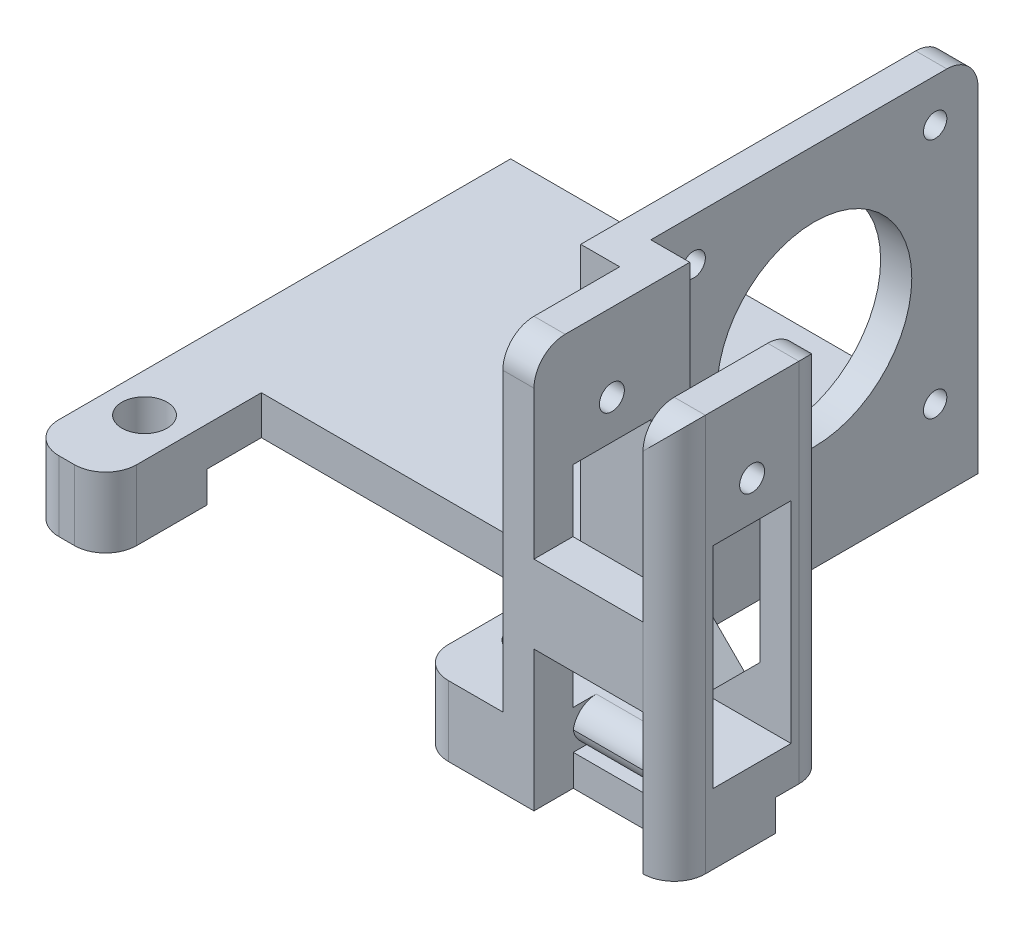
from build123d import *

# Parameters (mm, degrees)
EXTRUDE_1_DEPTH      = 5
SKETCH_3_W           = 4
SKETCH_3_H           = 42
EXTRUDE_2_DEPTH      = 42
SKETCH_4_R           = 1.5
CUT_EXTRUDE_1_DEPTH  = 42.5
SKETCH_5_R           = 12.5
CUT_EXTRUDE_2_DEPTH  = 42.5
SKETCH_6_R           = 1.5
CUT_EXTRUDE_3_DEPTH  = 42.5
SKETCH_7_W           = 20
SKETCH_7_H           = 5
EXTRUDE_3_DEPTH      = 5
EXTRUDE_5_DEPTH      = 42
SKETCH_11_W          = 20
SKETCH_11_H          = 5
EXTRUDE_6_DEPTH      = 18
SKETCH_12_W          = 4
SKETCH_12_H          = 20
EXTRUDE_7_DEPTH      = 42
CUT_EXTRUDE_4_REACH  = 106.221
SKETCH_13_R          = 1.6
CUT_EXTRUDE_START    = -22
SKETCH_15_W          = 10
SKETCH_15_H          = 27
CUT_EXTRUDE_5_DEPTH  = 22
SKETCH_16_W          = 5
SKETCH_16_H          = 5
CUT_EXTRUDE_6_DEPTH  = 42
EXTRUDE_START        = -22
SKETCH_17_W          = 10
SKETCH_17_H          = 5
EXTRUDE_8_DEPTH      = 22
CUT_EXTRUDE_7_DEPTH  = 5
FILLET_1_R           = 4
SKETCH_20_W          = 14
SKETCH_20_H          = 5
CUT_EXTRUDE_8_DEPTH  = 5
FILLET_3_R           = 3
SKETCH_21_R          = 2.9
CUT_EXTRUDE_9_DEPTH  = 3
EXTRUDE_9_DEPTH      = 4
SKETCH_24_R          = 1.5
CUT_EXTRUDE_10_DEPTH = 4
SKETCH_26_R          = 2.9
CUT_EXTRUDE_15_DEPTH = 4
CHAMFER_1_SIZE       = 7
EXTRUDE_10_REACH     = 103.064
SKETCH_28_W          = 5
SKETCH_28_H          = 10


# Some blends are built 0.0001 mm under size
with BuildPart() as part:
    # 草图1 → 凸台-拉伸1 (new body)
    with BuildSketch(Plane(origin=(0, 0, 0), x_dir=(1, 0, 0), z_dir=(0, 1, 0))):
        Polygon((10, 0), (50, 0), (50, -20), (60, -20), (60, 0), (60, 42), (0, 42), (0, 0), (0, -20), (10, -20), align=None)
    extrude(amount=EXTRUDE_1_DEPTH)

    # 草图3 → 凸台-拉伸2 (add)
    with BuildSketch(Plane(origin=(0, 5, 0), x_dir=(1, 0, 0), z_dir=(0, 1, 0))):
        with Locations((58, 21)):
            Rectangle(SKETCH_3_W, SKETCH_3_H)
    extrude(amount=EXTRUDE_2_DEPTH)

    # 草图4 → 切除-拉伸1 (cut)
    with BuildSketch(Plane.ZY.offset(-56)):
        with Locations((-36.5, 41.5)):
            Circle(SKETCH_4_R)
        with Locations((-5.5, 41.5)):
            Circle(SKETCH_4_R)
        with Locations((-5.5, 10.5)):
            Circle(SKETCH_4_R)
        with Locations((-36.5, 10.5)):
            Circle(SKETCH_4_R)
    extrude(amount=-CUT_EXTRUDE_1_DEPTH, mode=Mode.SUBTRACT)

    # 草图5 → 切除-拉伸2 (cut)
    with BuildSketch(Plane.ZY.offset(-56)):
        with Locations((-21, 26)):
            Circle(SKETCH_5_R)
    extrude(amount=-CUT_EXTRUDE_2_DEPTH, mode=Mode.SUBTRACT)

    # 草图6 → 切除-拉伸3 (cut)
    with BuildSketch(Plane(origin=(0, 5, 0), x_dir=(1, 0, 0), z_dir=(0, 1, 0))):
        with Locations(Location((55, -10, 0), (0, 0, 270))):
            Circle(SKETCH_6_R)
        with Locations(Location((5, -10, 0), (0, 0, 270))):
            Circle(SKETCH_6_R)
    extrude(amount=-CUT_EXTRUDE_3_DEPTH, mode=Mode.SUBTRACT)

    # 草图7 → 凸台-拉伸3 (add)
    with BuildSketch(Plane(origin=(60, 0, 0), x_dir=(0, 0, -1), z_dir=(1, 0, 0))):
        with Locations((-10, 2.5)):
            Rectangle(SKETCH_7_W, SKETCH_7_H)
    extrude(amount=EXTRUDE_3_DEPTH)

    # 草图8 → 凸台-拉伸5 (add)
    with BuildSketch(Plane(origin=(0, 5, 0), x_dir=(1, 0, 0), z_dir=(0, 1, 0))):
        Polygon((65, 0), (56, 0), (56, -5), (61, -5), (61, -15), (56, -15), (56, -20), (65, -20), align=None)
    extrude(amount=EXTRUDE_5_DEPTH)

    # 草图11 → 凸台-拉伸6 (add)
    with BuildSketch(Plane(origin=(65, 0, 0), x_dir=(0, 0, -1), z_dir=(1, 0, 0))):
        with Locations((-10, 2.5)):
            Rectangle(SKETCH_11_W, SKETCH_11_H)
    extrude(amount=EXTRUDE_6_DEPTH)

    # 草图12 → 凸台-拉伸7 (add)
    with BuildSketch(Plane(origin=(0, 5, 0), x_dir=(1, 0, 0), z_dir=(0, 1, 0))):
        with Locations((81, -10)):
            Rectangle(SKETCH_12_W, SKETCH_12_H)
    extrude(amount=EXTRUDE_7_DEPTH)

    # 切除-拉伸4: up to this face of the body (flat: up to its plane)
    cut_extrude_4_end = Plane(part.part.faces().sort_by_distance((61, 26, 10))[0])
    # 草图13 → 切除-拉伸4 (cut, up to the picked face)
    with BuildSketch(Plane(origin=(83, 0, 0), x_dir=(0, 0, -1), z_dir=(1, 0, 0)), mode=Mode.PRIVATE) as cut_extrude_4_sk1:
        with Locations((-10, 37)):
            Circle(SKETCH_13_R)
    cut_extrude_4_tool1 = split(extrude(cut_extrude_4_sk1.sketch, amount=-CUT_EXTRUDE_4_REACH, mode=Mode.PRIVATE), bisect_by=cut_extrude_4_end, keep=Keep.BOTH, mode=Mode.PRIVATE)
    add(cut_extrude_4_tool1.solids().sort_by(Axis((83, 37, 10), (-1, 0, 0)))[0], mode=Mode.SUBTRACT)

    # 草图15 → 切除-拉伸5 (cut)
    with BuildSketch(Plane.ZY.offset(-61).offset(CUT_EXTRUDE_START)):
        with Locations((10, 18.5)):
            Rectangle(SKETCH_15_W, SKETCH_15_H)
    extrude(amount=CUT_EXTRUDE_5_DEPTH, mode=Mode.SUBTRACT)

    # 草图16 → 切除-拉伸6 (cut)
    with BuildSketch(Plane(origin=(0, 47, 0), x_dir=(1, 0, 0), z_dir=(0, 1, 0))):
        with Locations((58.5, -17.5)):
            Rectangle(SKETCH_16_W, SKETCH_16_H)
    extrude(amount=-CUT_EXTRUDE_6_DEPTH, mode=Mode.SUBTRACT)

    # 草图17 → 凸台-拉伸8 (add)
    with BuildSketch(Plane.ZY.offset(-61).offset(EXTRUDE_START)):
        with Locations((10, 7.5)):
            Rectangle(SKETCH_17_W, SKETCH_17_H)
    extrude(amount=EXTRUDE_8_DEPTH)

    # 草图19 → 切除-拉伸7 (cut)
    with BuildSketch(Plane(origin=(0, 10, 0), x_dir=(1, 0, 0), z_dir=(0, 1, 0))):
        Polygon((79, -15), (83, -15), (83, -5), (79, -5), (65, -5), (61, -5), (61, -15), (65, -15), align=None)
    extrude(amount=-CUT_EXTRUDE_7_DEPTH, mode=Mode.SUBTRACT)

    # 圆角1
    fillet_1_edges = [part.edges().sort_by_distance(p)[0] for p in [
        (83, 23.5, 0),
        (83, 23.5, 20),
        (81, 47, 20),
        (81, 47, 0),
        (50, 2.5, 20),
        (10, 2.5, 20),
        (0, 2.5, 20),
        (58, 47, -42),
        (63, 47, 20),
    ]]
    fillet(fillet_1_edges, radius=FILLET_1_R - 0.0001)  # a hair under: the kernel refuses the full size

    # 草图20 → 切除-拉伸8 (cut)
    with BuildSketch(Plane.XY.offset(20)):
        with Locations((72, 2.5)):
            Rectangle(SKETCH_20_W, SKETCH_20_H)
    extrude(amount=-CUT_EXTRUDE_8_DEPTH, mode=Mode.SUBTRACT)

    # 圆角3
    # the kernel refuses this fillet: 3 mm, written as the material it takes off along each edge
    with BuildSketch(Plane(origin=(79, 0, 15), x_dir=(0, 0, -1), z_dir=(-1, 0, 0)), Plane(origin=(65, 5, 15), x_dir=(0, 0, -1), z_dir=(1, 0, 0))) as fillet_3_piece_1:
        with BuildLine():
            CenterArc((FILLET_3_R, -FILLET_3_R), FILLET_3_R, 90, 90)
            Line((0, -FILLET_3_R), (0, 0))
            Line((0, 0), (FILLET_3_R, 0))
        make_face()
    extrude(amount=14, mode=Mode.SUBTRACT)

    # 草图21 → 切除-拉伸9 (cut)
    with BuildSketch(Plane(origin=(0, 5, 0), x_dir=(1, 0, 0), z_dir=(0, 1, 0))):
        with Locations(Location((5, -10, 0), (0, 0, 270))):
            Circle(SKETCH_21_R)
        with Locations(Location((55, -10, 0), (0, 0, 270))):
            Circle(SKETCH_21_R)
    extrude(amount=-CUT_EXTRUDE_9_DEPTH, mode=Mode.SUBTRACT)

    # 草图23 → 凸台-拉伸9 (add)
    with BuildSketch(Plane.XZ):
        with BuildLine():
            Line((54, 20), (65, 20))
            Line((65, 20), (65, 14.958039892))
            Line((65, 14.958039892), (79, 14.958039892))
            Line((79, 14.958039892), (79, 20))
            ThreePointArc((79, 20), (81.828427125, 18.828427125), (83, 16))
            Line((83, 16), (83, 7))
            Line((83, 7), (50, 7))
            Line((50, 7), (50, 16))
            ThreePointArc((50, 16), (51.171572875, 18.828427125), (54, 20))
        make_face()
        with BuildLine():
            Line((4, 20), (6, 20))
            ThreePointArc((6, 20), (8.828427125, 18.828427125), (10, 16))
            Line((10, 16), (10, 7))
            Line((10, 7), (0, 7))
            Line((0, 7), (0, 16))
            ThreePointArc((0, 16), (1.171572875, 18.828427125), (4, 20))
        make_face()
    extrude(amount=EXTRUDE_9_DEPTH)

    # 草图24 → 切除-拉伸10 (cut)
    with BuildSketch(Plane(origin=(0, 0, 0), x_dir=(1, 0, 0), z_dir=(0, 1, 0))):
        with Locations(Location((55, -10, 0), (0, 0, 270))):
            Circle(SKETCH_24_R)
        with Locations(Location((5, -10, 0), (0, 0, 270))):
            Circle(SKETCH_24_R)
    extrude(amount=-CUT_EXTRUDE_10_DEPTH, mode=Mode.SUBTRACT)

    # 草图26 → 切除-拉伸15 (cut)
    with BuildSketch(Plane(origin=(0, 2, 0), x_dir=(1, 0, 0), z_dir=(0, 1, 0))):
        with Locations(Location((55, -10, 0), (0, 0, 270))):
            Circle(SKETCH_26_R)
        with Locations(Location((5, -10, 0), (0, 0, 270))):
            Circle(SKETCH_26_R)
    extrude(amount=-CUT_EXTRUDE_15_DEPTH, mode=Mode.SUBTRACT)

    # 倒角1
    chamfer_1_edges = [part.edges().sort_by_distance(p)[0] for p in [
        (79, 5, 2.5),
        (65, 5, 2.5),
    ]]
    chamfer(chamfer_1_edges, length=CHAMFER_1_SIZE - 0.0001)  # a hair under: the kernel refuses the full size

    # 草图28 → 凸台-拉伸10 (add, up to next)
    with BuildSketch(Plane.ZY.offset(-79), mode=Mode.PRIVATE) as extrude_10_sk1:
        with Locations((17.5, 19)):
            Rectangle(SKETCH_28_W, SKETCH_28_H)
    extrude_10_tool1 = extrude(extrude_10_sk1.sketch, amount=EXTRUDE_10_REACH, mode=Mode.PRIVATE) - part.part
    add(extrude_10_tool1.solids().sort_by_distance((79, 19, 17.5))[0])


solid = part.part
